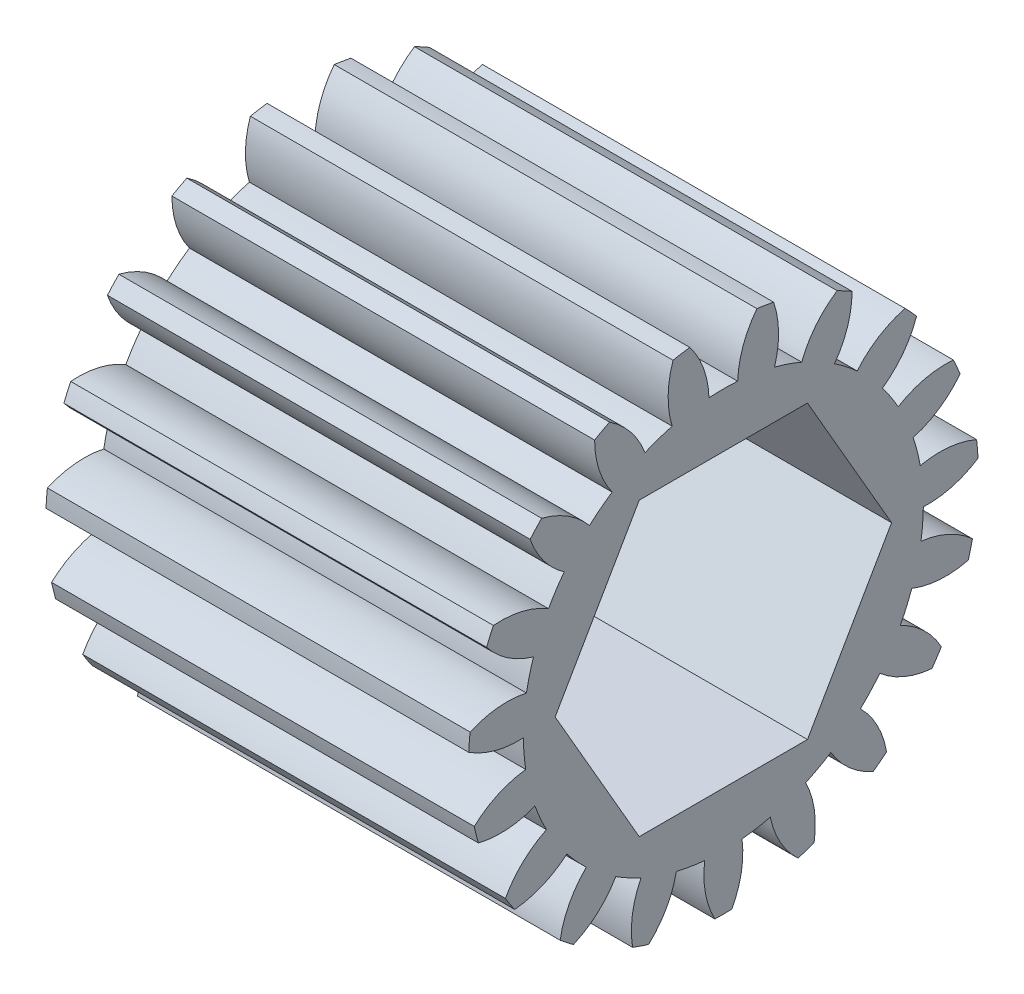
from build123d import *

# Parameters (mm, degrees)
SPUR_START             = -56.943752669
SPUR_GEAR_AI_OUTLINE_R = 4.7625
SPUR_GEAR_AI_DEPTH     = 13.8176
CUT_EXTRUDE1_DEPTH     = 40.482760103


# Read off the part's stored shape, not the designer's step: spur gear_ai
with BuildPart() as part:
    # spur gear_ai outline → spur gear_ai (new body)
    with BuildSketch(Plane.YZ.offset(SPUR_START)):
        with BuildLine():
            ThreePointArc((13.877482254, 21.299310941), (14.013498804, 21.54095532), (14.141401376, 21.786990765))
            ThreePointArc((14.141401376, 21.786990765), (13.511259094, 22.480540591), (12.698675372, 22.947229299))
            ThreePointArc((12.698675372, 22.947229299), (12.866749459, 23.385013416), (13.003007958, 23.833719839))
            ThreePointArc((13.003007958, 23.833719839), (13.930896828, 23.702903551), (14.85415475, 23.863170414))
            ThreePointArc((14.85415475, 23.863170414), (14.904339747, 24.135886336), (14.945424627, 24.410120799))
            ThreePointArc((14.945424627, 24.410120799), (14.124229931, 24.861485317), (13.20414066, 25.039042041))
            ThreePointArc((13.20414066, 25.039042041), (13.220959759, 25.507679374), (13.20414066, 25.976316707))
            ThreePointArc((13.20414066, 25.976316707), (14.124229931, 26.15387343), (14.945424627, 26.605237949))
            ThreePointArc((14.945424627, 26.605237949), (14.904339747, 26.879472412), (14.85415475, 27.152188334))
            ThreePointArc((14.85415475, 27.152188334), (13.930896828, 27.312455197), (13.003007958, 27.181638909))
            ThreePointArc((13.003007958, 27.181638909), (12.866749459, 27.630345332), (12.698675372, 28.068129449))
            ThreePointArc((12.698675372, 28.068129449), (13.511259094, 28.534818157), (14.141401376, 29.228367983))
            ThreePointArc((14.141401376, 29.228367983), (14.013498804, 29.474403428), (13.877482254, 29.716047807))
            ThreePointArc((13.877482254, 29.716047807), (12.952210428, 29.567849612), (12.117073115, 29.142836288))
            ThreePointArc((12.117073115, 29.142836288), (11.84250274, 29.522987496), (11.5413871, 29.882477695))
            ThreePointArc((11.5413871, 29.882477695), (12.158409219, 30.587725425), (12.529213394, 31.448303673))
            ThreePointArc((12.529213394, 31.448303673), (12.328353358, 31.639478342), (12.121244757, 31.82386526))
            ThreePointArc((12.121244757, 31.82386526), (11.294226586, 31.383261581), (10.642340918, 30.710108009))
            ThreePointArc((10.642340918, 30.710108009), (10.259212627, 30.980508721), (9.857685986, 31.222748662))
            ThreePointArc((9.857685986, 31.222748662), (10.212282581, 32.09013088), (10.283566263, 33.024480543))
            ThreePointArc((10.283566263, 33.024480543), (10.031515064, 33.140077693), (9.775757844, 33.247225967))
            ThreePointArc((9.775757844, 33.247225967), (9.13661358, 32.561963049), (8.738621482, 31.713615864))
            ThreePointArc((8.738621482, 31.713615864), (8.288453171, 31.844963967), (7.830027171, 31.943703192))
            ThreePointArc((7.830027171, 31.943703192), (7.883772199, 32.879225575), (7.647810695, 33.78609537))
            ThreePointArc((7.647810695, 33.78609537), (7.371881992, 33.813588258), (7.095191416, 33.831886709))
            ThreePointArc((7.095191416, 33.831886709), (6.713182256, 32.976223424), (6.612212349, 32.044614206))
            ThreePointArc((6.612212349, 32.044614206), (6.14378674, 32.022676095), (5.678138951, 31.967214677))
            ThreePointArc((5.678138951, 31.967214677), (5.425208304, 32.869498859), (4.907571703, 33.650615372))
            ThreePointArc((4.907571703, 33.650615372), (4.637666652, 33.587024715), (4.370026438, 33.514490423))
            ThreePointArc((4.370026438, 33.514490423), (4.286549003, 32.581151163), (4.493542942, 31.667234227))
            ThreePointArc((4.493542942, 31.667234227), (4.057621217, 31.494387237), (3.635211803, 31.290735282))
            ThreePointArc((3.635211803, 31.290735282), (3.103014441, 32.062004771), (2.359796702, 32.632721907))
            ThreePointArc((2.359796702, 32.632721907), (2.125163704, 32.484938741), (1.895576821, 32.329431921))
            ThreePointArc((1.895576821, 32.329431921), (2.119677185, 31.419558478), (2.612203966, 30.622370905))
            ThreePointArc((2.612203966, 30.622370905), (2.256025009, 30.317345688), (1.922628583, 29.987572046))
            ThreePointArc((1.922628583, 29.987572046), (1.168836349, 30.544247826), (0.280576646, 30.842719527))
            ThreePointArc((0.280576646, 30.842719527), (0.106641826, 30.626758451), (-0.060012425, 30.405130681))
            ThreePointArc((-0.060012425, 30.405130681), (0.447380989, 29.61732196), (1.172067692, 29.023251392))
            ThreePointArc((1.172067692, 29.023251392), (0.934229019, 28.619102165), (0.725974258, 28.198942925))
            ThreePointArc((0.725974258, 28.198942925), (-0.167727764, 28.480700538), (-1.10477271, 28.474582766))
            ThreePointArc((-1.10477271, 28.474582766), (-1.199160815, 28.213846513), (-1.284822859, 27.950114599))
            ThreePointArc((-1.284822859, 27.950114599), (-0.549120347, 27.369741899), (0.32919523, 27.043165102))
            ThreePointArc((0.32919523, 27.043165102), (0.235470351, 26.583687704), (0.17492489, 26.11867364))
            ThreePointArc((0.17492489, 26.11867364), (-0.761840439, 26.094980276), (-1.646127267, 25.784935985))
            ThreePointArc((-1.646127267, 25.784935985), (-1.650740241, 25.507679374), (-1.646127267, 25.230422763))
            ThreePointArc((-1.646127267, 25.230422763), (-0.761840439, 24.920378472), (0.17492489, 24.896685107))
            ThreePointArc((0.17492489, 24.896685107), (0.235470351, 24.431671044), (0.32919523, 23.972193646))
            ThreePointArc((0.32919523, 23.972193646), (-0.549120347, 23.645616848), (-1.284822859, 23.065244149))
            ThreePointArc((-1.284822859, 23.065244149), (-1.199160815, 22.801512235), (-1.10477271, 22.540775982))
            ThreePointArc((-1.10477271, 22.540775982), (-0.167727765, 22.53465821), (0.725974258, 22.816415822))
            ThreePointArc((0.725974258, 22.816415822), (0.934229019, 22.396256583), (1.172067692, 21.992107356))
            ThreePointArc((1.172067692, 21.992107356), (0.447380989, 21.398036788), (-0.060012425, 20.610228067))
            ThreePointArc((-0.060012425, 20.610228067), (0.106641826, 20.388600297), (0.280576646, 20.17263922))
            ThreePointArc((0.280576646, 20.17263922), (1.168836349, 20.471110922), (1.922628583, 21.027786702))
            ThreePointArc((1.922628583, 21.027786702), (2.256025009, 20.69801306), (2.612203966, 20.392987843))
            ThreePointArc((2.612203966, 20.392987843), (2.119677185, 19.59580027), (1.895576821, 18.685926827))
            ThreePointArc((1.895576821, 18.685926827), (2.125163704, 18.530420007), (2.359796702, 18.382636841))
            ThreePointArc((2.359796702, 18.382636841), (3.103014441, 18.953353977), (3.635211803, 19.724623466))
            ThreePointArc((3.635211803, 19.724623466), (4.057621217, 19.520971511), (4.493542942, 19.348124521))
            ThreePointArc((4.493542942, 19.348124521), (4.286549003, 18.434207585), (4.370026438, 17.500868325))
            ThreePointArc((4.370026438, 17.500868325), (4.637666652, 17.428334032), (4.907571703, 17.364743376))
            ThreePointArc((4.907571703, 17.364743376), (5.425208304, 18.145859889), (5.678138951, 19.048144071))
            ThreePointArc((5.678138951, 19.048144071), (6.14378674, 18.992682653), (6.612212349, 18.970744542))
            ThreePointArc((6.612212349, 18.970744542), (6.713182256, 18.039135324), (7.095191416, 17.183472039))
            ThreePointArc((7.095191416, 17.183472039), (7.371881992, 17.20177049), (7.647810695, 17.229263378))
            ThreePointArc((7.647810695, 17.229263378), (7.883772199, 18.136133173), (7.830027171, 19.071655555))
            ThreePointArc((7.830027171, 19.071655555), (8.288453171, 19.17039478), (8.738621482, 19.301742883))
            ThreePointArc((8.738621482, 19.301742883), (9.13661358, 18.453395698), (9.775757844, 17.768132781))
            ThreePointArc((9.775757844, 17.768132781), (10.031515064, 17.875281055), (10.283566263, 17.990878205))
            ThreePointArc((10.283566263, 17.990878205), (10.212282581, 18.925227868), (9.857685986, 19.792610086))
            ThreePointArc((9.857685986, 19.792610086), (10.259212627, 20.034850026), (10.642340918, 20.305250738))
            ThreePointArc((10.642340918, 20.305250738), (11.294226586, 19.632097166), (12.121244757, 19.191493488))
            ThreePointArc((12.121244757, 19.191493488), (12.328353358, 19.375880406), (12.529213394, 19.567055074))
            ThreePointArc((12.529213394, 19.567055074), (12.158409219, 20.427633322), (11.5413871, 21.132881053))
            ThreePointArc((11.5413871, 21.132881053), (11.84250274, 21.492371252), (12.117073115, 21.87252246))
            ThreePointArc((12.117073115, 21.87252246), (12.952210428, 21.447509136), (13.877482254, 21.299310941))
        make_face()
        with Locations((6.683634759, 25.507679374)):
            Circle(SPUR_GEAR_AI_OUTLINE_R, mode=Mode.SUBTRACT)
    extrude(amount=SPUR_GEAR_AI_DEPTH)

    # Sketch1 → Cut-Extrude1 (cut, through all)
    with BuildSketch(Plane(origin=(-43.126152669, 0, 0), x_dir=(0, 0, -1), z_dir=(1, 0, 0))):
        Polygon((-22.758048717, 11.446134759), (-28.257310031, 11.446134759), (-31.006940688, 6.683634759), (-28.257310031, 1.921134759), (-22.758048717, 1.921134759), (-20.00841806, 6.683634759), align=None)
    extrude(amount=-CUT_EXTRUDE1_DEPTH, mode=Mode.SUBTRACT)


solid = part.part
